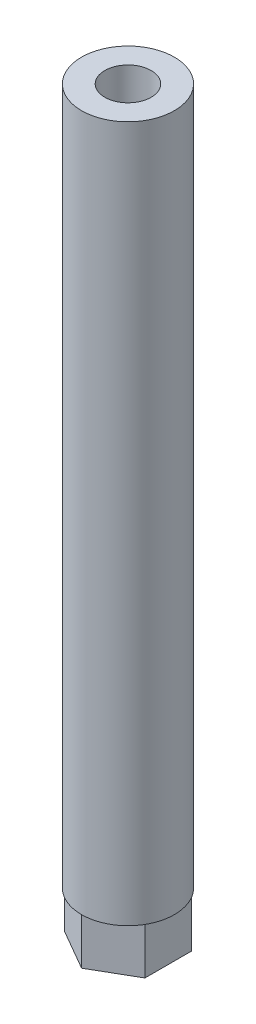
from build123d import *

# Parameters (mm, degrees)
CROQUIS1_R                 = 10
SALIENTE_EXTRUIR1_DEPTH    = 150
CROQUIS2_R                 = 1.75
SALIENTE_EXTRUIR2_DEPTH    = 10
CORTAR_EXTRUIR1_DEPTH      = 161.623784042
CORTAR_EXTRUIR1_DEPTH_BACK = 161.623784042
CROQUIS5_R                 = 5
SALIENTE_EXTRUIR4_START    = -30
CROQUIS7_R                 = 5
CROQUIS7_R_2               = 1.75
SALIENTE_EXTRUIR4_DEPTH    = 30


with BuildPart() as part:
    # Croquis1 → Saliente-Extruir1 (new body)
    with BuildSketch(Plane(origin=(0, 0, 0), x_dir=(1, 0, 0), z_dir=(0, 1, 0))):
        Circle(CROQUIS1_R)
    extrude(amount=SALIENTE_EXTRUIR1_DEPTH)

    # Croquis2 → Saliente-Extruir2 (add)
    with BuildSketch(Plane.XZ):
        Polygon((0, 9.988159657), (-8.65, 4.994079828), (-8.65, -4.994079828), (0, -9.988159657), (8.65, -4.994079828), (8.65, 4.994079828), align=None)
        Circle(CROQUIS2_R, mode=Mode.SUBTRACT)
    extrude(amount=SALIENTE_EXTRUIR2_DEPTH)

    # Croquis5 → Cortar-Extruir1 (cut, two sides: drawn at the far end of the back side and taken through both)
    with BuildSketch(Plane.XZ.offset(-150).offset(-CORTAR_EXTRUIR1_DEPTH_BACK)):
        Circle(CROQUIS5_R)
    extrude(amount=CORTAR_EXTRUIR1_DEPTH + CORTAR_EXTRUIR1_DEPTH_BACK, mode=Mode.SUBTRACT)

    # Croquis7 → Saliente-Extruir4 (add)
    with BuildSketch(Plane.XZ.offset(10).offset(SALIENTE_EXTRUIR4_START)):
        Circle(CROQUIS7_R)
        Circle(CROQUIS7_R_2, mode=Mode.SUBTRACT)
    extrude(amount=SALIENTE_EXTRUIR4_DEPTH)


solid = part.part
